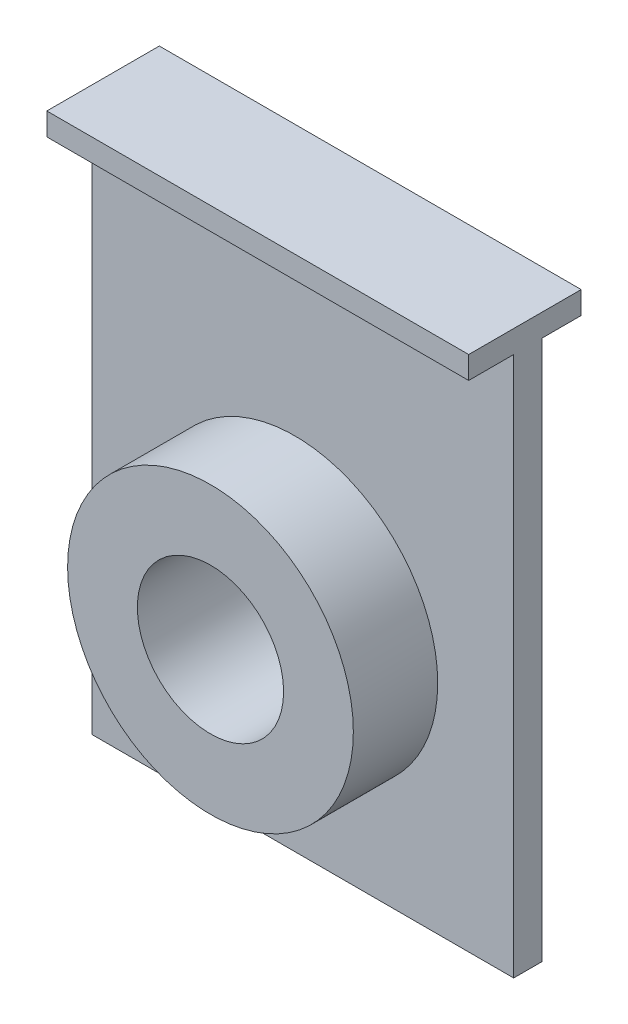
from build123d import *

# Parameters (mm, degrees)
SKETCH12_W                = 75
SKETCH12_H                = 100
BOSS_EXTRUDE10_DEPTH      = 5
SKETCH15_R                = 25.4
BOSS_EXTRUDE11_DEPTH      = 15
SKETCH23_R                = 13
CUT_EXTRUDE7_DEPTH        = 171.890311498
BOSS_EXTRUDE13_DEPTH      = 8
BOSS_EXTRUDE13_DEPTH_BACK = 12
SKETCH24_W                = 75
SKETCH24_H                = 4


with BuildPart() as part:
    # Sketch12 → Boss-Extrude10 (new body)
    with BuildSketch(Plane.XY):
        with Locations((99.625849364, 50)):
            Rectangle(SKETCH12_W, SKETCH12_H)
    extrude(amount=BOSS_EXTRUDE10_DEPTH)

    # Sketch15 → Boss-Extrude11 (add)
    with BuildSketch(Plane.XY.offset(5)):
        with Locations((98.219620603, 38.627603634)):
            Circle(SKETCH15_R)
    extrude(amount=BOSS_EXTRUDE11_DEPTH)

    # Sketch23 → Cut-Extrude7 (cut, through all)
    with BuildSketch(Plane.XY.offset(20)):
        with Locations((98.219620603, 38.627603634)):
            Circle(SKETCH23_R)
    extrude(amount=-CUT_EXTRUDE7_DEPTH, mode=Mode.SUBTRACT)

    # Sketch24 → Boss-Extrude13 (add, two sides: drawn at the far end of the back side and taken through both)
    with BuildSketch(Plane.XY.offset(5).offset(-BOSS_EXTRUDE13_DEPTH_BACK)):
        with Locations((99.625849364, 98)):
            Rectangle(SKETCH24_W, SKETCH24_H)
    extrude(amount=BOSS_EXTRUDE13_DEPTH + BOSS_EXTRUDE13_DEPTH_BACK)


solid = part.part
